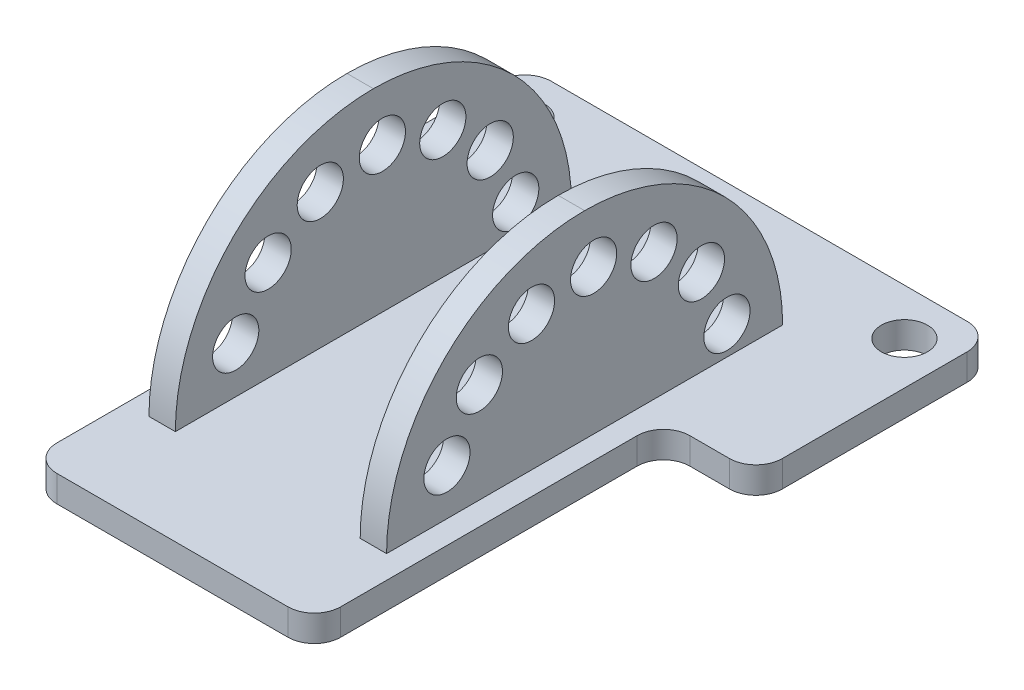
from build123d import *

# Parameters (mm, degrees)
SKETCH1_W               = 35.5
SKETCH1_H               = 44.45
BOSS_EXTRUDE1_DEPTH     = 2
SKETCH2_R               = 1.75
CUT_EXTRUDE1_DEPTH      = 29.513385015
SKETCH3_W               = 7
SKETCH3_H               = 26.45
CUT_EXTRUDE2_DEPTH      = 29.513385015
FILLET1_R               = 2
SKETCH4_W               = 2
SKETCH4_H               = 30
BOSS_EXTRUDE3_DEPTH     = 15
FILLET2_R               = 15
SKETCH5_R               = 1.75
CUT_EXTRUDE3_DEPTH      = 39.710633229
CIRPATTERN1_COUNT       = 7
CIRPATTERN1_ANGLE       = 150
MIRROR1_COPY_1_SKETCH_R = 1.75
MIRROR1_COPY_1_DEPTH    = 39.710633229
MIRROR1_COPY_2_SKETCH_R = 1.75
MIRROR1_COPY_2_DEPTH    = 39.710633229
MIRROR1_COPY_3_SKETCH_R = 1.75
MIRROR1_COPY_3_DEPTH    = 39.710633229
MIRROR1_COPY_4_SKETCH_R = 1.75
MIRROR1_COPY_4_DEPTH    = 39.710633229
MIRROR1_COPY_5_SKETCH_R = 1.75
MIRROR1_COPY_5_DEPTH    = 39.710633229
MIRROR1_COPY_6_SKETCH_R = 1.75
MIRROR1_COPY_6_DEPTH    = 39.710633229
FILLET2_OF_MIRROR1_R    = 15


with BuildPart() as part:
    # Sketch1 → Boss-Extrude1 (new body)
    with BuildSketch(Plane(origin=(0, 0, 0), x_dir=(1, 0, 0), z_dir=(0, 1, 0))):
        Rectangle(SKETCH1_W, SKETCH1_H)
    extrude(amount=BOSS_EXTRUDE1_DEPTH)

    # Sketch2 → Cut-Extrude1 (cut, through all)
    with BuildSketch(Plane(origin=(0, 2, 0), x_dir=(1, 0, 0), z_dir=(0, 1, 0))):
        with Locations(Location((-14.5, 18.725, 0), (0, 0, 270))):
            Circle(SKETCH2_R)
        with Locations(Location((14.5, 18.725, 0), (0, 0, 270))):
            Circle(SKETCH2_R)
    extrude(amount=-CUT_EXTRUDE1_DEPTH, mode=Mode.SUBTRACT)

    # Sketch3 → Cut-Extrude2 (cut, through all)
    with BuildSketch(Plane(origin=(0, 2, 0), x_dir=(1, 0, 0), z_dir=(0, 1, 0))):
        with Locations((-14.25, -9)):
            Rectangle(SKETCH3_W, SKETCH3_H)
        with Locations((14.25, -9)):
            Rectangle(SKETCH3_W, SKETCH3_H)
    extrude(amount=-CUT_EXTRUDE2_DEPTH, mode=Mode.SUBTRACT)

    # Fillet1
    fillet1_edges = [part.edges().sort_by_distance(p)[0] for p in [
        (-17.75, 1, -4.225),
        (-10.75, 1, -4.225),
        (-10.75, 1, 22.225),
        (17.75, 1, -4.225),
        (10.75, 1, 22.225),
        (10.75, 1, -4.225),
        (-17.75, 1, -22.225),
        (17.75, 1, -22.225),
    ]]
    fillet(fillet1_edges, radius=FILLET1_R)

    # Sketch4 → Boss-Extrude3 (add)
    with BuildSketch(Plane(origin=(0, 2, 0), x_dir=(1, 0, 0), z_dir=(0, 1, 0))):
        with Locations((-8, 0)):
            Rectangle(SKETCH4_W, SKETCH4_H)
    boss_extrude3 = extrude(amount=BOSS_EXTRUDE3_DEPTH)

    # Fillet2
    fillet2_edges = [part.edges().sort_by_distance(p)[0] for p in [
        (-8, 17, 15),
        (-8, 17, -15),
    ]]
    fillet(fillet2_edges, radius=FILLET2_R - 0.0001)  # a hair under: the kernel refuses the full size

    # Sketch5 → Cut-Extrude3 (cut, through all)
    with BuildSketch(Plane.ZY.offset(9)):
        with Locations((10.428326807, 5.5)):
            Circle(SKETCH5_R)
    cut_extrude3 = extrude(amount=-CUT_EXTRUDE3_DEPTH, mode=Mode.SUBTRACT)

    # CirPattern1: Cut-Extrude3 ×7 about axis
    cirpattern1_axis = Axis((0, 2, 0), (-1, 0, 0))
    for i in range(1, CIRPATTERN1_COUNT):
        add(cut_extrude3.rotate(cirpattern1_axis, i * CIRPATTERN1_ANGLE / (CIRPATTERN1_COUNT - 1)), mode=Mode.SUBTRACT)

    # Mirror1: Boss-Extrude3, Cut-Extrude3 across plane
    add(boss_extrude3.mirror(Plane(origin=(0, 0, 0), x_dir=(0, 0, 1), z_dir=(1, 0, 0))))
    add(cut_extrude3.mirror(Plane(origin=(0, 0, 0), x_dir=(0, 0, 1), z_dir=(1, 0, 0))), mode=Mode.SUBTRACT)

    # Mirror1 copy 1 sketch → Mirror1 copy 1 (cut, through all)
    with BuildSketch(Plane(origin=(9, 0.187384426, 0.845236523), x_dir=(0, 0.42261826174070033, 0.9063077870366495), z_dir=(1, 0, 0))):
        with Locations((10.428326807, -5.5)):
            Circle(MIRROR1_COPY_1_SKETCH_R)
    extrude(amount=-MIRROR1_COPY_1_DEPTH, mode=Mode.SUBTRACT)

    # Mirror1 copy 2 sketch → Mirror1 copy 2 (cut, through all)
    with BuildSketch(Plane(origin=(9, 0.714424781, 1.532088886), x_dir=(0, 0.7660444431189793, 0.6427876096865378), z_dir=(1, 0, 0))):
        with Locations((10.428326807, -5.5)):
            Circle(MIRROR1_COPY_2_SKETCH_R)
    extrude(amount=-MIRROR1_COPY_2_DEPTH, mode=Mode.SUBTRACT)

    # Mirror1 copy 3 sketch → Mirror1 copy 3 (cut, through all)
    with BuildSketch(Plane(origin=(9, 1.48236191, 1.931851653), x_dir=(0, 0.9659258262890691, 0.25881904510251796), z_dir=(1, 0, 0))):
        with Locations((10.428326807, -5.5)):
            Circle(MIRROR1_COPY_3_SKETCH_R)
    extrude(amount=-MIRROR1_COPY_3_DEPTH, mode=Mode.SUBTRACT)

    # Mirror1 copy 4 sketch → Mirror1 copy 4 (cut, through all)
    with BuildSketch(Plane(origin=(9, 2.347296355, 1.969615506), x_dir=(0, 0.9848077530122074, -0.17364817766693424), z_dir=(1, 0, 0))):
        with Locations((10.428326807, -5.5)):
            Circle(MIRROR1_COPY_4_SKETCH_R)
    extrude(amount=-MIRROR1_COPY_4_DEPTH, mode=Mode.SUBTRACT)

    # Mirror1 copy 5 sketch → Mirror1 copy 5 (cut, through all)
    with BuildSketch(Plane(origin=(9, 3.147152873, 1.638304089), x_dir=(0, 0.8191520442889889, -0.5735764363510502), z_dir=(1, 0, 0))):
        with Locations((10.428326807, -5.5)):
            Circle(MIRROR1_COPY_5_SKETCH_R)
    extrude(amount=-MIRROR1_COPY_5_DEPTH, mode=Mode.SUBTRACT)

    # Mirror1 copy 6 sketch → Mirror1 copy 6 (cut, through all)
    with BuildSketch(Plane(origin=(9, 3.732050808, 1), x_dir=(0, 0.49999999999999495, -0.8660254037844416), z_dir=(1, 0, 0))):
        with Locations((10.428326807, -5.5)):
            Circle(MIRROR1_COPY_6_SKETCH_R)
    extrude(amount=-MIRROR1_COPY_6_DEPTH, mode=Mode.SUBTRACT)

    # Fillet2 of Mirror1
    fillet2_of_mirror1_edges = [part.edges().sort_by_distance(p)[0] for p in [
        (8, 17, 15),
        (8, 17, -15),
    ]]
    fillet(fillet2_of_mirror1_edges, radius=FILLET2_OF_MIRROR1_R - 0.0001)  # a hair under: the kernel refuses the full size


solid = part.part
